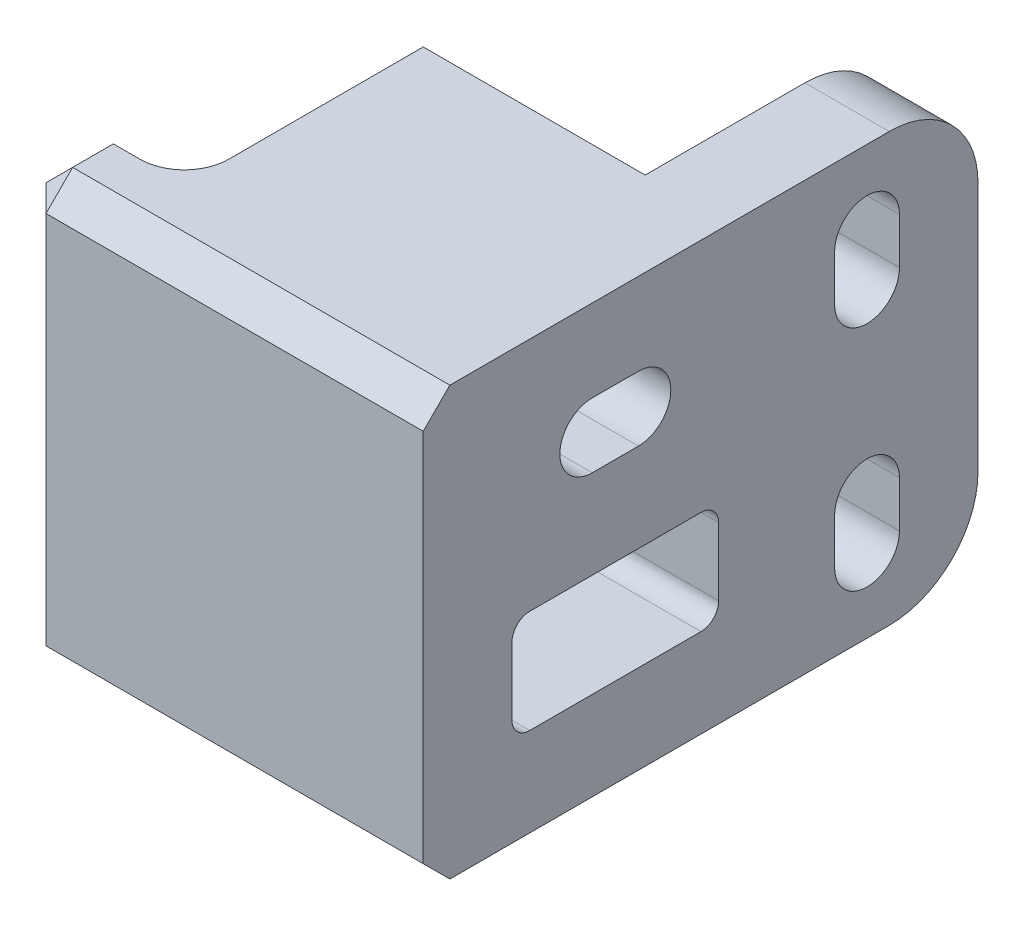
from build123d import *

# Parameters (mm, degrees)
SKETCH1_W                 = 6.35
SKETCH1_H                 = 12.24
BOSS_EXTRUDE1_DEPTH       = 8.255
BOSS_EXTRUDE2_DEPTH       = 2.032
BOSS_EXTRUDE2_DEPTH_BACK  = 6.35
SKETCH3_W                 = 1.458
SKETCH3_H                 = 2.216
CUT_EXTRUDE1_DEPTH        = 3.81
SKETCH9_W                 = 15.875
SKETCH9_H                 = 12.24
BOSS_EXTRUDE3_DEPTH       = 3.175
FILLET2_R                 = 2.54
F_0_START                 = 50.038
F_0_CLEARANCE_SLOT1_DEPTH = 9.525
F_0_START_2               = 56.388
F_0_CLEARANCE_SLOT2_DEPTH = 3.175
FILLET3_R                 = 0.508
SKETCH12_W                = 5.914
SKETCH12_H                = 2.952219173
CUT_EXTRUDE2_DEPTH        = 31.407781492
FILLET4_R                 = 0.508


# Read off the part's stored shape, not the designer's step: #0 Clearance Slot1, #0 Clearance Slot2
with BuildPart() as part:
    # Sketch1 → Boss-Extrude1 (new body)
    with BuildSketch(Plane.XY):
        with Locations((53.213, -20.344)):
            Rectangle(SKETCH1_W, SKETCH1_H)
    extrude(amount=BOSS_EXTRUDE1_DEPTH)

    # Sketch2 → Boss-Extrude2 (add, two sides: drawn at the far end of the back side and taken through both)
    with BuildSketch(Plane.ZY.offset(-50.038).offset(-BOSS_EXTRUDE2_DEPTH_BACK)):
        Polygon((9.525, -26.464), (6.836, -26.464), (6.836, -23.46), (8.148, -23.46), (8.148, -20.644), (6.836, -20.644), (6.836, -14.224), (9.525, -14.224), align=None)
    extrude(amount=BOSS_EXTRUDE2_DEPTH + BOSS_EXTRUDE2_DEPTH_BACK)

    # Sketch3 → Cut-Extrude1 (cut)
    with BuildSketch(Plane.XZ.offset(26.464)):
        with Locations((50.767, 5.178)):
            Rectangle(SKETCH3_W, SKETCH3_H)
    extrude(amount=-CUT_EXTRUDE1_DEPTH, mode=Mode.SUBTRACT)

    # Sketch9 → Boss-Extrude3 (add)
    with BuildSketch(Plane(origin=(56.388, 0, 0), x_dir=(0, 0, -1), z_dir=(1, 0, 0))):
        with Locations((-1.5875, -20.344)):
            Rectangle(SKETCH9_W, SKETCH9_H)
    extrude(amount=BOSS_EXTRUDE3_DEPTH)

    # Fillet2
    fillet2_edges = [part.edges().sort_by_distance(p)[0] for p in [
        (57.9755, -14.224, -6.35),
        (57.9755, -26.464, -6.35),
    ]]
    fillet(fillet2_edges, radius=FILLET2_R)

    # #0 Clearance Slot1 outline → #0 Clearance Slot1 (cut)
    with BuildSketch(Plane.YZ.offset(F_0_START)):
        with BuildLine():
            Line((-18.431780827, 4.6884), (-18.431780827, 3.3676))
            ThreePointArc((-18.431780827, 3.3676), (-17.504680827, 2.4405), (-16.577580827, 3.3676))
            Line((-16.577580827, 3.3676), (-16.577580827, 4.6884))
            ThreePointArc((-16.577580827, 4.6884), (-17.504680827, 5.6155), (-18.431780827, 4.6884))
        make_face()
    extrude(amount=F_0_CLEARANCE_SLOT1_DEPTH, mode=Mode.SUBTRACT)

    # #0 Clearance Slot2 outline → #0 Clearance Slot2 (cut)
    with BuildSketch(Plane.YZ.offset(F_0_START_2)):
        with BuildLine():
            Line((-22.9461, -2.2479), (-24.2669, -2.2479))
            ThreePointArc((-24.2669, -2.2479), (-25.194, -3.175), (-24.2669, -4.1021))
            Line((-24.2669, -4.1021), (-22.9461, -4.1021))
            ThreePointArc((-22.9461, -4.1021), (-22.019, -3.175), (-22.9461, -2.2479))
        make_face()
        with BuildLine():
            ThreePointArc((-16.4211, -4.1021), (-15.494, -3.175), (-16.4211, -2.2479))
            Line((-16.4211, -2.2479), (-17.7419, -2.2479))
            ThreePointArc((-17.7419, -2.2479), (-18.669, -3.175), (-17.7419, -4.1021))
            Line((-17.7419, -4.1021), (-16.4211, -4.1021))
        make_face()
    extrude(amount=F_0_CLEARANCE_SLOT2_DEPTH, mode=Mode.SUBTRACT)

    # Fillet3
    fillet3_edges = [part.edges().sort_by_distance(p)[0] for p in [
        (50.038, -17.434, 6.836),
        (50.038, -20.644, 7.492),
        (50.038, -22.052, 8.148),
        (50.038, -23.46, 7.492),
        (49.022, -23.46, 8.148),
        (49.022, -20.644, 8.148),
        (50.038, -24.962, 6.836),
        (50.767, -22.654, 6.286),
        (51.496, -22.654, 5.178),
        (51.496, -24.559, 6.286),
        (50.767, -22.654, 4.07),
        (51.496, -24.559, 4.07),
    ]]
    fillet(fillet3_edges, radius=FILLET3_R)

    # Chamfer3
    # the kernel refuses this chamfer: 0.762 mm, written as the material it takes off along each edge
    with BuildSketch(Plane(origin=(48.514, -25.956, 9.017), x_dir=(0, -0.7071067811865475, -0.7071067811865475), z_dir=(-0.5773502691896257, -0.5773502691896257, 0.5773502691896257)), Plane(origin=(48.514, -14.732, 9.017), x_dir=(0, -0.7071067811865475, 0.7071067811865475), z_dir=(-0.5773502691896257, 0.5773502691896257, 0.5773502691896257))) as chamfer3_piece_1:
        Polygon((-0.538815367, 0.311085197), (0.538815367, 0.311085197), (0, -0.622170395), align=None)
    extrude(amount=0.967869991, mode=Mode.SUBTRACT)
    with BuildSketch(Plane(origin=(49.53, -14.224, 6.836), x_dir=(0, 0.027495876610587274, 0.9996219169112966), z_dir=(-1, 0, 0)), Plane(origin=(46.046377563, -26.464, 6.836), x_dir=(0, -0.027495876610587274, 0.9996219169112966), z_dir=(1, 0, 0))) as chamfer3_piece_2:
        with BuildLine():
            Line((0.783848975, 0), (-0.043088932, -0.782663759))
            Line((-0.043088932, -0.782663759), (-0.05832317, -0.782244722))
            ThreePointArc((-0.05832317, -0.782244722), (-0.026006471, -0.391209146), (-0.015234238, 0.000419037))
            Line((-0.015234238, 0.000419037), (0.000419037, 0.015234238))
            ThreePointArc((0.000419037, 0.015234238), (0.392047221, 0.004462005), (0.784268012, 0.015234238))
            Line((0.784268012, 0.015234238), (0.783848975, 0))
        make_face()
    extrude(amount=3.483622437, mode=Mode.SUBTRACT)
    with BuildSketch(Plane(origin=(49.53, -14.224, 6.328), x_dir=(1, 0, 0), z_dir=(0, 0, -1))) as chamfer3_piece_3:
        with BuildLine():
            Line((1.291552615, -0.021552615), (0.486447385, 0.783552615))
            Line((0.486447385, 0.783552615), (0.471207385, 0.783552615))
            ThreePointArc((0.471207385, 0.783552615), (0.49276, 0.391776307), (0.49276, 0))
            Line((0.49276, 0), (0.508, -0.01524))
            ThreePointArc((0.508, -0.01524), (0.899776307, -0.01524), (1.291552615, -0.036792615))
            Line((1.291552615, -0.036792615), (1.291552615, -0.021552615))
        make_face()
    revolve(axis=Axis((49.53, -14.224, 6.328), (0, -1, 0)), revolution_arc=90, mode=Mode.SUBTRACT)
    with BuildSketch(Plane(origin=(50.038, -14.224, -1.959622437), x_dir=(0.9996219169112966, 0.027495876610587368, 0), z_dir=(0, 0, 1))) as chamfer3_piece_4:
        with BuildLine():
            Line((0.783848975, 0), (-0.043088932, -0.782663759))
            Line((-0.043088932, -0.782663759), (-0.05832317, -0.782244722))
            ThreePointArc((-0.05832317, -0.782244722), (-0.026006471, -0.391209146), (-0.015234238, 0.000419037))
            Line((-0.015234238, 0.000419037), (0.000419037, 0.015234238))
            ThreePointArc((0.000419037, 0.015234238), (0.392047221, 0.004462005), (0.784268012, 0.015234238))
            Line((0.784268012, 0.015234238), (0.783848975, 0))
        make_face()
    extrude(amount=8.287622437, mode=Mode.SUBTRACT)
    with BuildSketch(Plane(origin=(56.388, -14.224, 0), x_dir=(0, 0.02749587661058728, 0.9996219169112966), z_dir=(-1, 0, 0))) as chamfer3_piece_5:
        with BuildLine():
            Line((0.783848975, 0), (-0.043088932, -0.782663759))
            Line((-0.043088932, -0.782663759), (-0.05832317, -0.782244722))
            ThreePointArc((-0.05832317, -0.782244722), (-0.026006471, -0.391209146), (-0.015234238, 0.000419037))
            Line((-0.015234238, 0.000419037), (0.000419037, 0.015234238))
            ThreePointArc((0.000419037, 0.015234238), (0.392047221, 0.004462005), (0.784268012, 0.015234238))
            Line((0.784268012, 0.015234238), (0.783848975, 0))
        make_face()
    extrude(amount=8.309622437, mode=Mode.SUBTRACT)
    with BuildSketch(Plane(origin=(49.53, -26.464, 6.328), x_dir=(1, 0, 0), z_dir=(0, 0, -1))) as chamfer3_piece_6:
        with BuildLine():
            Line((1.291552615, 0.021552615), (0.486447385, -0.783552615))
            Line((0.486447385, -0.783552615), (0.471207385, -0.783552615))
            ThreePointArc((0.471207385, -0.783552615), (0.49276, -0.391776307), (0.49276, 0))
            Line((0.49276, 0), (0.508, 0.01524))
            ThreePointArc((0.508, 0.01524), (0.899776307, 0.01524), (1.291552615, 0.036792615))
            Line((1.291552615, 0.036792615), (1.291552615, 0.021552615))
        make_face()
    revolve(axis=Axis((49.53, -26.464, 6.328), (0, -1, 0)), revolution_arc=90, mode=Mode.SUBTRACT)
    with BuildSketch(Plane(origin=(46.046377563, -26.464, 9.525), x_dir=(0, 0.9996219169112968, 0.027495876610587246), z_dir=(1, 0, 0)), Plane(origin=(46.046377563, -14.224, 9.525), x_dir=(0, 0.027495876610587246, -0.9996219169112968), z_dir=(1, 0, 0))) as chamfer3_piece_7:
        with BuildLine():
            Line((0.783848975, 0), (-0.043088932, -0.782663759))
            Line((-0.043088932, -0.782663759), (-0.05832317, -0.782244722))
            ThreePointArc((-0.05832317, -0.782244722), (-0.026006471, -0.391209146), (-0.015234238, 0.000419037))
            Line((-0.015234238, 0.000419037), (0.000419037, 0.015234238))
            ThreePointArc((0.000419037, 0.015234238), (0.392047221, 0.004462005), (0.784268012, 0.015234238))
            Line((0.784268012, 0.015234238), (0.783848975, 0))
        make_face()
    extrude(amount=15.476244874, mode=Mode.SUBTRACT)
    with BuildSketch(Plane(origin=(48.006, -14.224, 4.876377563), x_dir=(0.9996219169112966, 0.027495876610587368, 0), z_dir=(0, 0, 1))) as chamfer3_piece_8:
        with BuildLine():
            Line((0.783848975, 0), (-0.043088932, -0.782663759))
            Line((-0.043088932, -0.782663759), (-0.05832317, -0.782244722))
            ThreePointArc((-0.05832317, -0.782244722), (-0.026006471, -0.391209146), (-0.015234238, 0.000419037))
            Line((-0.015234238, 0.000419037), (0.000419037, 0.015234238))
            ThreePointArc((0.000419037, 0.015234238), (0.392047221, 0.004462005), (0.784268012, 0.015234238))
            Line((0.784268012, 0.015234238), (0.783848975, 0))
        make_face()
    extrude(amount=6.608244874, mode=Mode.SUBTRACT)
    with BuildSketch(Plane(origin=(48.006, -12.264377563, 9.525), x_dir=(-0.027495876610582715, 0, -0.9996219169112968), z_dir=(0, -1, 0))) as chamfer3_piece_9:
        with BuildLine():
            Line((0.783848975, 0), (-0.043088932, 0.782663759))
            Line((-0.043088932, 0.782663759), (-0.05832317, 0.782244722))
            ThreePointArc((-0.05832317, 0.782244722), (-0.026006471, 0.391209146), (-0.015234238, -0.000419037))
            Line((-0.015234238, -0.000419037), (0.000419037, -0.015234238))
            ThreePointArc((0.000419037, -0.015234238), (0.392047221, -0.004462005), (0.784268012, -0.015234238))
            Line((0.784268012, -0.015234238), (0.783848975, 0))
        make_face()
    extrude(amount=16.159244874, mode=Mode.SUBTRACT)
    with BuildSketch(Plane(origin=(48.006, -26.464, 11.484622437), x_dir=(-0.027495876610582715, 0.9996219169112968, 0), z_dir=(0, 0, -1))) as chamfer3_piece_10:
        with BuildLine():
            Line((0.783848975, 0), (-0.043088932, 0.782663759))
            Line((-0.043088932, 0.782663759), (-0.05832317, 0.782244722))
            ThreePointArc((-0.05832317, 0.782244722), (-0.026006471, 0.391209146), (-0.015234238, -0.000419037))
            Line((-0.015234238, -0.000419037), (0.000419037, -0.015234238))
            ThreePointArc((0.000419037, -0.015234238), (0.392047221, -0.004462005), (0.784268012, -0.015234238))
            Line((0.784268012, -0.015234238), (0.783848975, 0))
        make_face()
    extrude(amount=6.608244874, mode=Mode.SUBTRACT)
    with BuildSketch(Plane(origin=(56.388, -14.224, 0), x_dir=(0.9996219169112966, 0.027495876610587368, 0), z_dir=(0, 0, -1))) as chamfer3_piece_11:
        with BuildLine():
            Line((0.783848975, 0), (-0.043088932, 0.782663759))
            Line((-0.043088932, 0.782663759), (-0.05832317, 0.782244722))
            ThreePointArc((-0.05832317, 0.782244722), (-0.026006471, 0.391209146), (-0.015234238, -0.000419037))
            Line((-0.015234238, -0.000419037), (0.000419037, -0.015234238))
            ThreePointArc((0.000419037, -0.015234238), (0.392047221, -0.004462005), (0.784268012, -0.015234238))
            Line((0.784268012, -0.015234238), (0.783848975, 0))
        make_face()
    extrude(amount=3.81, mode=Mode.SUBTRACT)
    with BuildSketch(Plane(origin=(50.988, -26.464, 6.286), x_dir=(0, -0.027495876610587305, 0.9996219169112966), z_dir=(-1, 0, 0)), Plane(origin=(48.078377563, -26.464, 4.07), x_dir=(0, -0.027495876610587288, -0.9996219169112966), z_dir=(1, 0, 0))) as chamfer3_piece_12:
        with BuildLine():
            Line((0.783848975, 0), (-0.043088932, 0.782663759))
            Line((-0.043088932, 0.782663759), (-0.05832317, 0.782244722))
            ThreePointArc((-0.05832317, 0.782244722), (-0.026006471, 0.391209146), (-0.015234238, -0.000419037))
            Line((-0.015234238, -0.000419037), (0.000419037, -0.015234238))
            ThreePointArc((0.000419037, -0.015234238), (0.392047221, -0.004462005), (0.784268012, -0.015234238))
            Line((0.784268012, -0.015234238), (0.783848975, 0))
        make_face()
    extrude(amount=2.909622437, mode=Mode.SUBTRACT)
    with BuildSketch(Plane(origin=(56.388, -16.764, -3.81), x_dir=(0, 1, 0), z_dir=(0, 0, 1))) as chamfer3_piece_13:
        with BuildLine():
            Line((1.756447385, 0.021552615), (2.561552615, -0.783552615))
            Line((2.561552615, -0.783552615), (2.576792615, -0.783552615))
            ThreePointArc((2.576792615, -0.783552615), (2.55524, -0.391776307), (2.55524, 0))
            Line((2.55524, 0), (2.54, 0.01524))
            ThreePointArc((2.54, 0.01524), (2.148223693, 0.01524), (1.756447385, 0.036792615))
            Line((1.756447385, 0.036792615), (1.756447385, 0.021552615))
        make_face()
    revolve(axis=Axis((56.388, -16.764, -3.81), (-1, 0, 0)), revolution_arc=90, mode=Mode.SUBTRACT)
    with BuildSketch(Plane(origin=(50.988, -26.464, 5.778), x_dir=(0, 0, 1), z_dir=(-1, 0, 0))) as chamfer3_piece_14:
        with BuildLine():
            Line((1.291552615, -0.021552615), (0.486447385, 0.783552615))
            Line((0.486447385, 0.783552615), (0.471207385, 0.783552615))
            ThreePointArc((0.471207385, 0.783552615), (0.49276, 0.391776307), (0.49276, 0))
            Line((0.49276, 0), (0.508, -0.01524))
            ThreePointArc((0.508, -0.01524), (0.899776307, -0.01524), (1.291552615, -0.036792615))
            Line((1.291552615, -0.036792615), (1.291552615, -0.021552615))
        make_face()
    revolve(axis=Axis((50.988, -26.464, 5.778), (0, 1, 0)), revolution_arc=90, mode=Mode.SUBTRACT)
    with BuildSketch(Plane(origin=(56.388, -16.764, -6.35), x_dir=(-0.027495876610582747, 0, 0.9996219169112968), z_dir=(0, -1, 0))) as chamfer3_piece_15:
        with BuildLine():
            Line((0.783848975, 0), (-0.043088932, -0.782663759))
            Line((-0.043088932, -0.782663759), (-0.05832317, -0.782244722))
            ThreePointArc((-0.05832317, -0.782244722), (-0.026006471, -0.391209146), (-0.015234238, 0.000419037))
            Line((-0.015234238, 0.000419037), (0.000419037, 0.015234238))
            ThreePointArc((0.000419037, 0.015234238), (0.392047221, 0.004462005), (0.784268012, 0.015234238))
            Line((0.784268012, 0.015234238), (0.783848975, 0))
        make_face()
    extrude(amount=7.16, mode=Mode.SUBTRACT)
    with BuildSketch(Plane(origin=(51.496, -26.464, 4.578), x_dir=(0.9996219169112966, -0.027495876610587368, 0), z_dir=(0, 0, 1))) as chamfer3_piece_16:
        with BuildLine():
            Line((0.783848975, 0), (-0.043088932, 0.782663759))
            Line((-0.043088932, 0.782663759), (-0.05832317, 0.782244722))
            ThreePointArc((-0.05832317, 0.782244722), (-0.026006471, 0.391209146), (-0.015234238, -0.000419037))
            Line((-0.015234238, -0.000419037), (0.000419037, -0.015234238))
            ThreePointArc((0.000419037, -0.015234238), (0.392047221, -0.004462005), (0.784268012, -0.015234238))
            Line((0.784268012, -0.015234238), (0.783848975, 0))
        make_face()
    extrude(amount=1.2, mode=Mode.SUBTRACT)
    with BuildSketch(Plane(origin=(56.388, -23.924, -3.81), x_dir=(0, -1, 0), z_dir=(0, 0, 1))) as chamfer3_piece_17:
        with BuildLine():
            Line((1.756447385, -0.021552615), (2.561552615, 0.783552615))
            Line((2.561552615, 0.783552615), (2.576792615, 0.783552615))
            ThreePointArc((2.576792615, 0.783552615), (2.55524, 0.391776307), (2.55524, 0))
            Line((2.55524, 0), (2.54, -0.01524))
            ThreePointArc((2.54, -0.01524), (2.148223693, -0.01524), (1.756447385, -0.036792615))
            Line((1.756447385, -0.036792615), (1.756447385, -0.021552615))
        make_face()
    revolve(axis=Axis((56.388, -23.924, -3.81), (1, 0, 0)), revolution_arc=90, mode=Mode.SUBTRACT)
    with BuildSketch(Plane(origin=(50.988, -26.464, 4.578), x_dir=(0, 0, -1), z_dir=(-1, 0, 0))) as chamfer3_piece_18:
        with BuildLine():
            Line((1.291552615, 0.021552615), (0.486447385, -0.783552615))
            Line((0.486447385, -0.783552615), (0.471207385, -0.783552615))
            ThreePointArc((0.471207385, -0.783552615), (0.49276, -0.391776307), (0.49276, 0))
            Line((0.49276, 0), (0.508, 0.01524))
            ThreePointArc((0.508, 0.01524), (0.899776307, 0.01524), (1.291552615, 0.036792615))
            Line((1.291552615, 0.036792615), (1.291552615, 0.021552615))
        make_face()
    revolve(axis=Axis((50.988, -26.464, 4.578), (0, -1, 0)), revolution_arc=90, mode=Mode.SUBTRACT)
    with BuildSketch(Plane(origin=(56.388, -26.464, -3.81), x_dir=(-0.027495876610582715, 0.9996219169112968, 0), z_dir=(0, 0, 1))) as chamfer3_piece_19:
        with BuildLine():
            Line((0.783848975, 0), (-0.043088932, -0.782663759))
            Line((-0.043088932, -0.782663759), (-0.05832317, -0.782244722))
            ThreePointArc((-0.05832317, -0.782244722), (-0.026006471, -0.391209146), (-0.015234238, 0.000419037))
            Line((-0.015234238, 0.000419037), (0.000419037, 0.015234238))
            ThreePointArc((0.000419037, 0.015234238), (0.392047221, 0.004462005), (0.784268012, 0.015234238))
            Line((0.784268012, 0.015234238), (0.783848975, 0))
        make_face()
    extrude(amount=3.81, mode=Mode.SUBTRACT)
    with BuildSketch(Plane(origin=(50.038, -26.464, -1.959622437), x_dir=(-0.027495876610582715, 0.9996219169112968, 0), z_dir=(0, 0, 1))) as chamfer3_piece_20:
        with BuildLine():
            Line((0.783848975, 0), (-0.043088932, -0.782663759))
            Line((-0.043088932, -0.782663759), (-0.05832317, -0.782244722))
            ThreePointArc((-0.05832317, -0.782244722), (-0.026006471, -0.391209146), (-0.015234238, 0.000419037))
            Line((-0.015234238, 0.000419037), (0.000419037, 0.015234238))
            ThreePointArc((0.000419037, 0.015234238), (0.392047221, 0.004462005), (0.784268012, 0.015234238))
            Line((0.784268012, 0.015234238), (0.783848975, 0))
        make_face()
    extrude(amount=7.989244874, mode=Mode.SUBTRACT)
    with BuildSketch(Plane(origin=(48.078377563, -26.464, 0), x_dir=(0, 0.9996219169112968, -0.027495876610586327), z_dir=(1, 0, 0))) as chamfer3_piece_21:
        with BuildLine():
            Line((0.783848975, 0), (-0.043088932, 0.782663759))
            Line((-0.043088932, 0.782663759), (-0.05832317, 0.782244722))
            ThreePointArc((-0.05832317, 0.782244722), (-0.026006471, 0.391209146), (-0.015234238, -0.000419037))
            Line((-0.015234238, -0.000419037), (0.000419037, -0.015234238))
            ThreePointArc((0.000419037, -0.015234238), (0.392047221, -0.004462005), (0.784268012, -0.015234238))
            Line((0.784268012, -0.015234238), (0.783848975, 0))
        make_face()
    extrude(amount=8.309622437, mode=Mode.SUBTRACT)
    with BuildSketch(Plane(origin=(50.038, -26.464, 4.326377563), x_dir=(-0.027495876610582715, 0.9996219169112968, 0), z_dir=(0, 0, 1))) as chamfer3_piece_22:
        with BuildLine():
            Line((0.783848975, 0), (-0.043088932, -0.782663759))
            Line((-0.043088932, -0.782663759), (-0.05832317, -0.782244722))
            ThreePointArc((-0.05832317, -0.782244722), (-0.026006471, -0.391209146), (-0.015234238, 0.000419037))
            Line((-0.015234238, 0.000419037), (0.000419037, 0.015234238))
            ThreePointArc((0.000419037, 0.015234238), (0.392047221, 0.004462005), (0.784268012, 0.015234238))
            Line((0.784268012, 0.015234238), (0.783848975, 0))
        make_face()
    extrude(amount=2.001622437, mode=Mode.SUBTRACT)
    with BuildSketch(Plane(origin=(58.347622437, -14.224, 0), x_dir=(0, 0.02749587661058728, 0.9996219169112966), z_dir=(-1, 0, 0))) as chamfer3_piece_23a_section:
        with BuildLine():
            Line((0.783848975, 0), (-0.043088932, -0.782663759))
            Line((-0.043088932, -0.782663759), (-0.05832317, -0.782244722))
            ThreePointArc((-0.05832317, -0.782244722), (-0.026006471, -0.391209146), (-0.015234238, 0.000419037))
            Line((-0.015234238, 0.000419037), (0.000419037, 0.015234238))
            ThreePointArc((0.000419037, 0.015234238), (0.392047221, 0.004462005), (0.784268012, 0.015234238))
            Line((0.784268012, 0.015234238), (0.783848975, 0))
        make_face()
    chamfer3_piece_23a = extrude(amount=10.269244874, mode=Mode.PRIVATE)
    chamfer3_piece_23a = split(chamfer3_piece_23a, bisect_by=Plane(origin=(56.388, -14.475302744, 0.251302744), z_dir=(1, 0, 0)), keep=Keep.TOP, mode=Mode.PRIVATE)
    with BuildSketch(Plane(origin=(56.388, -14.224, 1.959622437), x_dir=(0.9996219169112966, 0.027495876610587368, 0), z_dir=(0, 0, -1))) as chamfer3_piece_23b_section:
        with BuildLine():
            Line((0.783848975, 0), (-0.043088932, 0.782663759))
            Line((-0.043088932, 0.782663759), (-0.05832317, 0.782244722))
            ThreePointArc((-0.05832317, 0.782244722), (-0.026006471, 0.391209146), (-0.015234238, -0.000419037))
            Line((-0.015234238, -0.000419037), (0.000419037, -0.015234238))
            ThreePointArc((0.000419037, -0.015234238), (0.392047221, -0.004462005), (0.784268012, -0.015234238))
            Line((0.784268012, -0.015234238), (0.783848975, 0))
        make_face()
    chamfer3_piece_23b = extrude(amount=5.769622437, mode=Mode.PRIVATE)
    chamfer3_piece_23b = split(chamfer3_piece_23b, bisect_by=Plane(origin=(56.639302744, -14.475302744, 0), z_dir=(0, 0, 1)), keep=Keep.TOP, mode=Mode.PRIVATE)
    chamfer3_piece_23 = chamfer3_piece_23a & chamfer3_piece_23b
    add(chamfer3_piece_23, mode=Mode.SUBTRACT)
    with BuildSketch(Plane(origin=(48.078377563, -26.464, 0), x_dir=(0, 0.9996219169112968, -0.027495876610586327), z_dir=(1, 0, 0))) as chamfer3_piece_24a_section:
        with BuildLine():
            Line((0.783848975, 0), (-0.043088932, 0.782663759))
            Line((-0.043088932, 0.782663759), (-0.05832317, 0.782244722))
            ThreePointArc((-0.05832317, 0.782244722), (-0.026006471, 0.391209146), (-0.015234238, -0.000419037))
            Line((-0.015234238, -0.000419037), (0.000419037, -0.015234238))
            ThreePointArc((0.000419037, -0.015234238), (0.392047221, -0.004462005), (0.784268012, -0.015234238))
            Line((0.784268012, -0.015234238), (0.783848975, 0))
        make_face()
    chamfer3_piece_24a = extrude(amount=10.269244874, mode=Mode.PRIVATE)
    chamfer3_piece_24a = split(chamfer3_piece_24a, bisect_by=Plane(origin=(56.388, -26.212697256, 0.251302744), z_dir=(1, 0, 0)), keep=Keep.TOP, mode=Mode.PRIVATE)
    with BuildSketch(Plane(origin=(56.388, -26.464, -3.81), x_dir=(-0.027495876610582715, 0.9996219169112968, 0), z_dir=(0, 0, 1))) as chamfer3_piece_24b_section:
        with BuildLine():
            Line((0.783848975, 0), (-0.043088932, -0.782663759))
            Line((-0.043088932, -0.782663759), (-0.05832317, -0.782244722))
            ThreePointArc((-0.05832317, -0.782244722), (-0.026006471, -0.391209146), (-0.015234238, 0.000419037))
            Line((-0.015234238, 0.000419037), (0.000419037, 0.015234238))
            ThreePointArc((0.000419037, 0.015234238), (0.392047221, 0.004462005), (0.784268012, 0.015234238))
            Line((0.784268012, 0.015234238), (0.783848975, 0))
        make_face()
    chamfer3_piece_24b = extrude(amount=5.769622437, mode=Mode.PRIVATE)
    chamfer3_piece_24b = split(chamfer3_piece_24b, bisect_by=Plane(origin=(56.639302744, -26.212697256, 0), z_dir=(0, 0, 1)), keep=Keep.TOP, mode=Mode.PRIVATE)
    chamfer3_piece_24 = chamfer3_piece_24a & chamfer3_piece_24b
    add(chamfer3_piece_24, mode=Mode.SUBTRACT)

    # Sketch12 → Cut-Extrude2 (cut, through all)
    with BuildSketch(Plane(origin=(59.563, 0, 0), x_dir=(0, 0, -1), z_dir=(1, 0, 0))):
        with Locations((-4.028, -22.447890414)):
            Rectangle(SKETCH12_W, SKETCH12_H)
    extrude(amount=-CUT_EXTRUDE2_DEPTH, mode=Mode.SUBTRACT)

    # Fillet4
    fillet4_edges = [part.edges().sort_by_distance(p)[0] for p in [
        (53.7845, -23.924, 6.985),
        (54.8005, -23.924, 1.071),
        (54.8005, -20.971780827, 1.071),
        (54.783978972, -20.971780827, 6.985),
    ]]
    fillet(fillet4_edges, radius=FILLET4_R)


solid = part.part
